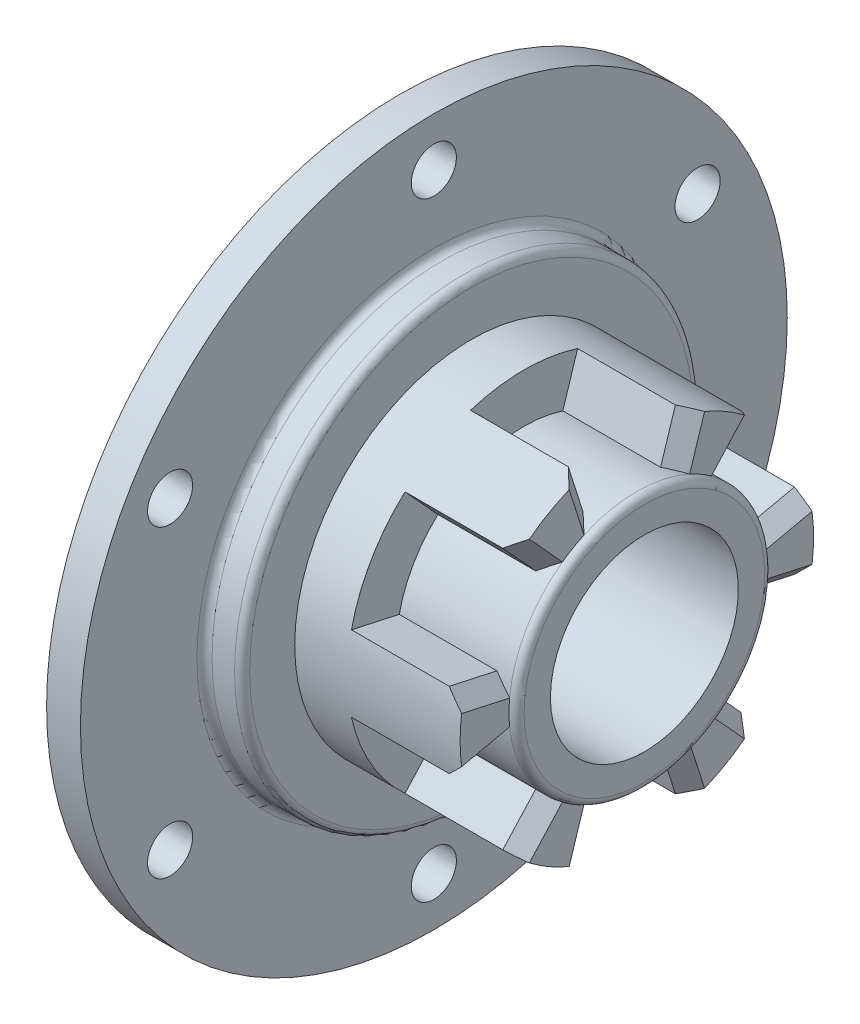
from build123d import *
from build123d.topology import SkipClean

# Parameters (mm, degrees)
CUT_EXTRUDE1_DEPTH = 15
SKETCH3_R          = 3.0000000000000018
CUT_EXTRUDE2_DEPTH = 15
CIRPATTERN2_COUNT  = 6
FILLET1_R          = 1
CHAMFER1_SIZE      = 2
SCALE1_SCALE       = 2


# Some blends are built 0.0001 mm under size
with BuildPart() as part:
    # Sketch1 → Revolve1 (revolve)
    with BuildSketch(Plane.XY, mode=Mode.PRIVATE) as revolve1_sk:
        Polygon((0, 31.5), (0, 34), (3.5, 34), (3.5, 47), (8, 47), (8.000000000000004, 30.499999999999993), (13.000000000000005, 30.499999999999993), (13.000000000000005, 23.499999999999996), (35, 23.49999999999999), (35, 17.000000000000004), (36.00000000000001, 17.000000000000007), (36.00000000000001, 12.500000000000007), (14.000000000000005, 12.5), (14.000000000000005, 14.5), (9.500000000000005, 14.500000000000002), (9.500000000000005, 27.07007724752754), align=None)
    revolve(revolve1_sk.sketch.rotate(Axis((0, 0, 0), (1, 0, 0)), 90), axis=Axis((0, 0, 0), (1, 0, 0)))

    # Sketch2 → Cut-Extrude1 (cut)
    with BuildSketch(Plane(origin=(35, 0, 0), x_dir=(0, 0, -1), z_dir=(1, 0, 0))):
        with BuildLine():
            Line((-7.121328836370207, 22.395014525654634), (-5.151599583757172, 16.200648805792717))
            ThreePointArc((-5.151599583757172, 16.200648805792717), (-6.51e-15, 17), (5.151599583757166, 16.200648805792717))
            Line((5.151599583757166, 16.200648805792717), (7.121328836370199, 22.395014525654634))
            ThreePointArc((7.121328836370199, 22.395014525654634), (-3.78e-15, 23.499999999999996), (-7.121328836370207, 22.395014525654634))
        make_face()
    cut_extrude1 = extrude(amount=-CUT_EXTRUDE1_DEPTH, mode=Mode.SUBTRACT)

    # Sketch3 → Cut-Extrude2 (cut)
    with BuildSketch(Plane(origin=(8.000000000000002, 0, 0), x_dir=(0, 0, -1), z_dir=(1, 0, 0))):
        with Locations((0, 40.5)):
            Circle(SKETCH3_R)
    cut_extrude2 = extrude(amount=-CUT_EXTRUDE2_DEPTH, mode=Mode.SUBTRACT)

    # CirPattern2: Cut-Extrude1, Cut-Extrude2 ×6 about axis
    with SkipClean():  # the faces are left unmerged after this step: merging them gives an invalid solid
        cirpattern2_axis = Axis((0, -8.4e-16, -2.024e-14), (1, 0, 0))
        add([cut_extrude1.rotate(cirpattern2_axis, i * 360 / CIRPATTERN2_COUNT) for i in range(1, CIRPATTERN2_COUNT)], mode=Mode.SUBTRACT)
        add([cut_extrude2.rotate(cirpattern2_axis, i * 360 / CIRPATTERN2_COUNT) for i in range(1, CIRPATTERN2_COUNT)], mode=Mode.SUBTRACT)

    # Fillet1
    fillet1_edges = [part.edges().sort_by_distance(p)[0] for p in [
        (36.00000000000001, -3.97e-15, -17.000000000000007),
        (13.000000000000005, -7.12e-15, -30.499999999999993),
        (8.000000000000004, -7.12e-15, -30.499999999999993),
    ]]
    fillet(fillet1_edges, radius=FILLET1_R - 0.0001)  # a hair under: the kernel refuses the full size

    # Chamfer1
    # the kernel refuses this chamfer: 2 mm, written as the material it takes off along each edge
    with BuildSketch(Plane(origin=(35, -8.761174115451754, -7.988842125078546), x_dir=(0.027495876610585633, -0.6735319368685933, 0.7386465371119375), z_dir=(0, -0.7389259125032596, -0.6737866842192901))) as chamfer1_piece_1_section:
        Polygon((CHAMFER1_SIZE * 0.999621916911, CHAMFER1_SIZE * 0.0274958766106), (-CHAMFER1_SIZE * 0.0274958766106, CHAMFER1_SIZE * 0.999621916911), (0, 0), align=None)
    chamfer1_piece_1 = extrude(amount=16.786731951863647, mode=Mode.PRIVATE)
    chamfer1_piece_1 = chamfer1_piece_1 - Plane(origin=(34.34095626935287, 0, 0), x_dir=(0, 1.1e-16, 1), z_dir=(1, 0, 0)) * Cylinder(17.000000000000004, 42, mode=Mode.PRIVATE)
    add(chamfer1_piece_1, mode=Mode.SUBTRACT)
    with BuildSketch(Plane(origin=(35, -6.131210705649978, -27.979468717509512), x_dir=(-0.9996219169112968, -0.026858575913627898, 0.005885586672240668), z_dir=(0, 0.21405342901395988, 0.9768219538520649))) as chamfer1_piece_2_section:
        Polygon((CHAMFER1_SIZE * 0.999621916911, -CHAMFER1_SIZE * 0.0274958766106), (-CHAMFER1_SIZE * 0.0274958766106, -CHAMFER1_SIZE * 0.999621916911), (0, 0), align=None)
    chamfer1_piece_2 = extrude(amount=16.786731951863644, mode=Mode.PRIVATE)
    chamfer1_piece_2 = chamfer1_piece_2 - Plane(origin=(34.34095626935968, 5.449e-14, 2.889e-14), x_dir=(0, -0.21405342901396118, -0.9768219538520647), z_dir=(1, 0, 0)) * Cylinder(17.00000000000007, 42, mode=Mode.PRIVATE)
    add(chamfer1_piece_2, mode=Mode.SUBTRACT)
    with BuildSketch(Plane(origin=(35, 2.537953169415396, -11.581820413499162), x_dir=(0.02749587661058563, -0.9764526339906394, -0.21397249903237056), z_dir=(0, 0.21405342901395968, -0.976821953852065))) as chamfer1_piece_3_section:
        Polygon((CHAMFER1_SIZE * 0.999621916911, CHAMFER1_SIZE * 0.0274958766106), (-CHAMFER1_SIZE * 0.0274958766106, CHAMFER1_SIZE * 0.999621916911), (0, 0), align=None)
    chamfer1_piece_3 = extrude(amount=16.786731951863636, mode=Mode.PRIVATE)
    chamfer1_piece_3 = chamfer1_piece_3 - Plane(origin=(34.34095626935361, 0, 0), x_dir=(0, 1.1e-16, 1), z_dir=(1, 0, 0)) * Cylinder(17.000000000000004, 42, mode=Mode.PRIVATE)
    add(chamfer1_piece_3, mode=Mode.SUBTRACT)
    with BuildSketch(Plane(origin=(35, 21.165325340930252, -19.299518585802748), x_dir=(-0.9996219169112968, -0.018526355531149796, -0.020317415714554633), z_dir=(0, -0.7389259125032593, 0.6737866842192902))) as chamfer1_piece_4_section:
        Polygon((CHAMFER1_SIZE * 0.999621916911, -CHAMFER1_SIZE * 0.0274958766106), (-CHAMFER1_SIZE * 0.0274958766106, -CHAMFER1_SIZE * 0.999621916911), (0, 0), align=None)
    chamfer1_piece_4 = extrude(amount=16.786731951863647, mode=Mode.PRIVATE)
    chamfer1_piece_4 = chamfer1_piece_4 - Plane(origin=(34.340956269359076, -1.572e-14, 5.224e-14), x_dir=(0, 0.7389259125032586, -0.6737866842192912), z_dir=(1, 0, 0)) * Cylinder(17.00000000000007, 42, mode=Mode.PRIVATE)
    add(chamfer1_piece_4, mode=Mode.SUBTRACT)
    with BuildSketch(Plane(origin=(35, 11.299127284867144, -3.592978288420628), x_dir=(0.027495876610585616, -0.3029206971220457, -0.9526190361443074), z_dir=(0, 0.9529793415172187, -0.30303526963277455))) as chamfer1_piece_5_section:
        Polygon((CHAMFER1_SIZE * 0.999621916911, CHAMFER1_SIZE * 0.0274958766106), (-CHAMFER1_SIZE * 0.0274958766106, CHAMFER1_SIZE * 0.999621916911), (0, 0), align=None)
    chamfer1_piece_5 = extrude(amount=16.78673195186364, mode=Mode.PRIVATE)
    chamfer1_piece_5 = chamfer1_piece_5 - Plane(origin=(34.340956269353335, 0, 0), x_dir=(0, 1.1e-16, 1), z_dir=(1, 0, 0)) * Cylinder(17.000000000000004, 42, mode=Mode.PRIVATE)
    add(chamfer1_piece_5, mode=Mode.SUBTRACT)
    with BuildSketch(Plane(origin=(35, 27.296536046580208, 8.679950131706747), x_dir=(-0.9996219169112968, 0.008332220382478566, -0.026203002386795352), z_dir=(0, -0.9529793415172185, -0.3030352696327747))) as chamfer1_piece_6_section:
        Polygon((CHAMFER1_SIZE * 0.999621916911, -CHAMFER1_SIZE * 0.0274958766106), (-CHAMFER1_SIZE * 0.0274958766106, -CHAMFER1_SIZE * 0.999621916911), (0, 0), align=None)
    chamfer1_piece_6 = extrude(amount=16.78673195186364, mode=Mode.PRIVATE)
    chamfer1_piece_6 = chamfer1_piece_6 - Plane(origin=(34.340956269359246, -7.105e-14, 3.11e-15), x_dir=(0, 0.9529793415172191, 0.3030352696327735), z_dir=(1, 0, 0)) * Cylinder(17.00000000000007, 42, mode=Mode.PRIVATE)
    add(chamfer1_piece_6, mode=Mode.SUBTRACT)
    with BuildSketch(Plane(origin=(35, 8.761174115451746, 7.988842125078507), x_dir=(0.027495876610585623, 0.6735319368685936, -0.738646537111937), z_dir=(0, 0.7389259125032592, 0.6737866842192906))) as chamfer1_piece_7_section:
        Polygon((CHAMFER1_SIZE * 0.999621916911, CHAMFER1_SIZE * 0.0274958766106), (-CHAMFER1_SIZE * 0.0274958766106, CHAMFER1_SIZE * 0.999621916911), (0, 0), align=None)
    chamfer1_piece_7 = extrude(amount=16.786731951863654, mode=Mode.PRIVATE)
    chamfer1_piece_7 = chamfer1_piece_7 - Plane(origin=(34.34095626935326, 0, 0), x_dir=(0, 1.1e-16, 1), z_dir=(1, 0, 0)) * Cylinder(17.000000000000004, 42, mode=Mode.PRIVATE)
    add(chamfer1_piece_7, mode=Mode.SUBTRACT)
    with BuildSketch(Plane(origin=(35, 6.131210705649962, 27.97946871750947), x_dir=(0.027495876610585616, -0.9764526339906394, 0.21397249903237028), z_dir=(0, -0.21405342901395943, -0.976821953852065))) as chamfer1_piece_8_section:
        Polygon((CHAMFER1_SIZE * 0.999621916911, CHAMFER1_SIZE * 0.0274958766106), (-CHAMFER1_SIZE * 0.0274958766106, CHAMFER1_SIZE * 0.999621916911), (0, 0), align=None)
    chamfer1_piece_8 = extrude(amount=16.786731951863636, mode=Mode.PRIVATE)
    chamfer1_piece_8 = chamfer1_piece_8 - Plane(origin=(34.34095626952976, 0, 0), x_dir=(0, 1.1e-16, 1), z_dir=(1, 0, 0)) * Cylinder(17.000000000000004, 42, mode=Mode.PRIVATE)
    add(chamfer1_piece_8, mode=Mode.SUBTRACT)
    with BuildSketch(Plane(origin=(35, -2.537953169415392, 11.581820413499123), x_dir=(0.027495876610585623, 0.9764526339906394, 0.21397249903237017), z_dir=(0, -0.2140534290139593, 0.976821953852065))) as chamfer1_piece_9_section:
        Polygon((CHAMFER1_SIZE * 0.999621916911, CHAMFER1_SIZE * 0.0274958766106), (-CHAMFER1_SIZE * 0.0274958766106, CHAMFER1_SIZE * 0.999621916911), (0, 0), align=None)
    chamfer1_piece_9 = extrude(amount=16.786731951863636, mode=Mode.PRIVATE)
    chamfer1_piece_9 = chamfer1_piece_9 - Plane(origin=(34.34095626935359, 0, 0), x_dir=(0, 1.1e-16, 1), z_dir=(1, 0, 0)) * Cylinder(17.000000000000004, 42, mode=Mode.PRIVATE)
    add(chamfer1_piece_9, mode=Mode.SUBTRACT)
    with BuildSketch(Plane(origin=(35, -21.165325340930245, 19.299518585802712), x_dir=(-0.9996219169112968, 0.018526355531149803, 0.020317415714554626), z_dir=(0, 0.7389259125032591, -0.6737866842192906))) as chamfer1_piece_10_section:
        Polygon((CHAMFER1_SIZE * 0.999621916911, -CHAMFER1_SIZE * 0.0274958766106), (-CHAMFER1_SIZE * 0.0274958766106, -CHAMFER1_SIZE * 0.999621916911), (0, 0), align=None)
    chamfer1_piece_10 = extrude(amount=16.786731951863633, mode=Mode.PRIVATE)
    chamfer1_piece_10 = chamfer1_piece_10 - Plane(origin=(34.34095626935918, 1.405e-14, -9.273e-14), x_dir=(0, -0.7389259125032583, 0.6737866842192916), z_dir=(1, 0, 0)) * Cylinder(17.00000000000007, 42, mode=Mode.PRIVATE)
    add(chamfer1_piece_10, mode=Mode.SUBTRACT)
    with BuildSketch(Plane(origin=(35, -11.299127284867144, 3.5929782884205888), x_dir=(0.027495876610585616, 0.30292069712204583, 0.9526190361443074), z_dir=(0, -0.9529793415172187, 0.30303526963277466))) as chamfer1_piece_11_section:
        Polygon((CHAMFER1_SIZE * 0.999621916911, CHAMFER1_SIZE * 0.0274958766106), (-CHAMFER1_SIZE * 0.0274958766106, CHAMFER1_SIZE * 0.999621916911), (0, 0), align=None)
    chamfer1_piece_11 = extrude(amount=16.78673195186364, mode=Mode.PRIVATE)
    chamfer1_piece_11 = chamfer1_piece_11 - Plane(origin=(34.34095626935327, 0, 0), x_dir=(0, 1.1e-16, 1), z_dir=(1, 0, 0)) * Cylinder(17.000000000000004, 42, mode=Mode.PRIVATE)
    add(chamfer1_piece_11, mode=Mode.SUBTRACT)
    with BuildSketch(Plane(origin=(35, -27.296536046580208, -8.679950131706784), x_dir=(-0.9996219169112968, -0.008332220382478562, 0.026203002386795352), z_dir=(0, 0.9529793415172186, 0.30303526963277466))) as chamfer1_piece_12_section:
        Polygon((CHAMFER1_SIZE * 0.999621916911, -CHAMFER1_SIZE * 0.0274958766106), (-CHAMFER1_SIZE * 0.0274958766106, -CHAMFER1_SIZE * 0.999621916911), (0, 0), align=None)
    chamfer1_piece_12 = extrude(amount=16.786731951863636, mode=Mode.PRIVATE)
    chamfer1_piece_12 = chamfer1_piece_12 - Plane(origin=(34.34095626935956, 6.938e-14, -4.359e-14), x_dir=(0, -0.9529793415172191, -0.3030352696327734), z_dir=(1, 0, 0)) * Cylinder(17.00000000000007, 42, mode=Mode.PRIVATE)
    add(chamfer1_piece_12, mode=Mode.SUBTRACT)


with BuildPart() as part_1:
    # Scale1: scaled about (13.438191471, 0, 0)
    add(part.part.scale(SCALE1_SCALE).moved(Location((-13.438191471, 0, 0))))


solid = part_1.part
